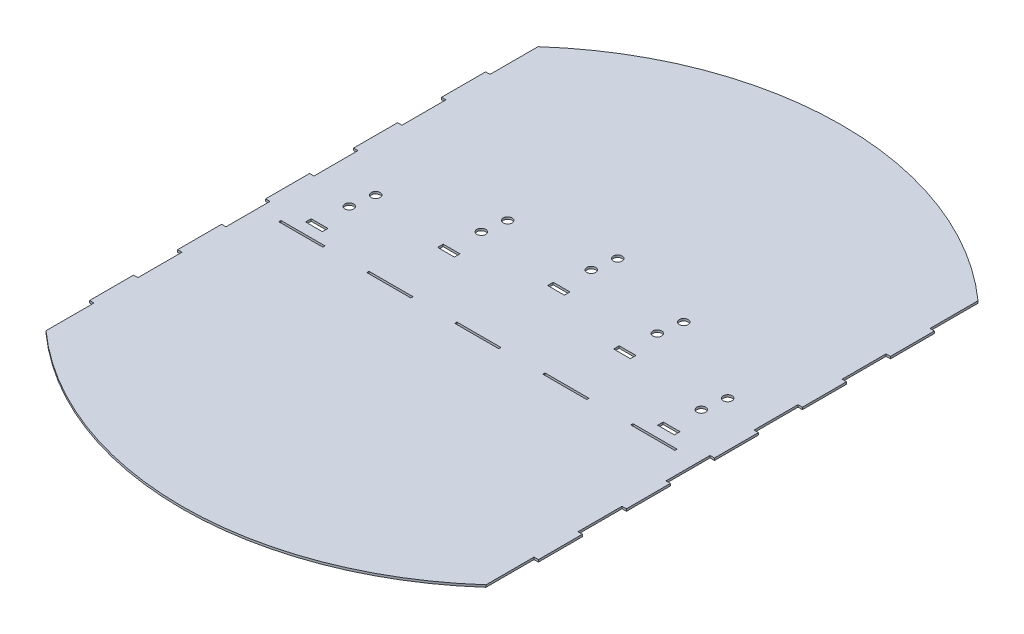
from build123d import *

# Parameters (mm, degrees)
SKICA1_R                = 2
SKICA1_W                = 7.62
SKICA1_H                = 2.54
SKICA1_W_2              = 20
SKICA1_H_2              = 1
P_IDAT_VYSUNUT_M1_DEPTH = 1


with BuildPart() as part:
    # Skica1 → Přidat vysunutím1 (new body)
    with BuildSketch(Plane(origin=(0, 0, 0), x_dir=(1, 0, 0), z_dir=(0, 1, 0))):
        with BuildLine():
            Line((-102, 10), (-102, -10))
            Line((-102, -10), (-100, -10))
            Line((-100, -10), (-100, -30))
            Line((-100, -30), (-102, -30))
            Line((-102, -30), (-102, -50))
            Line((-102, -50), (-100, -50))
            Line((-100, -50), (-100, -70))
            Line((-100, -70), (-102, -70))
            Line((-102, -70), (-102, -90))
            Line((-102, -90), (-100, -90))
            Line((-100, -90), (-100, -111.803398875))
            ThreePointArc((-100, -111.803398875), (0, -150), (100, -111.803398875))
            Line((100, -111.803398875), (100, -90))
            Line((100, -90), (102, -90))
            Line((102, -90), (102, -70))
            Line((102, -70), (100, -70))
            Line((100, -70), (100, -50))
            Line((100, -50), (102, -50))
            Line((102, -50), (102, -30))
            Line((102, -30), (100, -30))
            Line((100, -30), (100, -10))
            Line((100, -10), (102, -10))
            Line((102, -10), (102, 10))
            Line((102, 10), (100, 10))
            Line((100, 10), (100, 30))
            Line((100, 30), (102, 30))
            Line((102, 30), (102, 50))
            Line((102, 50), (100, 50))
            Line((100, 50), (100, 70))
            Line((100, 70), (102, 70))
            Line((102, 70), (102, 90))
            Line((102, 90), (100, 90))
            Line((100, 90), (100, 111.803398875))
            ThreePointArc((100, 111.803398875), (0, 150), (-100, 111.803398875))
            Line((-100, 111.803398875), (-100, 90))
            Line((-100, 90), (-102, 90))
            Line((-102, 90), (-102, 70))
            Line((-102, 70), (-100, 70))
            Line((-100, 70), (-100, 50))
            Line((-100, 50), (-102, 50))
            Line((-102, 50), (-102, 30))
            Line((-102, 30), (-100, 30))
            Line((-100, 30), (-100, 10))
            Line((-100, 10), (-102, 10))
        make_face()
        with Locations((1.5, 46.54)):
            Circle(SKICA1_R, mode=Mode.SUBTRACT)
        with Locations((0, 36.04)):
            Circle(SKICA1_R, mode=Mode.SUBTRACT)
        with Locations((0, 21.27)):
            Rectangle(SKICA1_W, SKICA1_H, mode=Mode.SUBTRACT)
        with Locations((-80, 6.04)):
            Circle(SKICA1_R, mode=Mode.SUBTRACT)
        with Locations((-78.5, 16.54)):
            Circle(SKICA1_R, mode=Mode.SUBTRACT)
        Polygon((-36.19, 10), (-43.81, 10), (-43.81, 12.54), (-40, 12.54), (-36.19, 12.54), align=None, mode=Mode.SUBTRACT)
        with Locations((-40, 26.04)):
            Circle(SKICA1_R, mode=Mode.SUBTRACT)
        with Locations((-38.5, 36.54)):
            Circle(SKICA1_R, mode=Mode.SUBTRACT)
        with Locations((80, 6.04)):
            Circle(SKICA1_R, mode=Mode.SUBTRACT)
        with Locations((81.5, 16.54)):
            Circle(SKICA1_R, mode=Mode.SUBTRACT)
        Polygon((43.81, 12.54), (43.81, 10), (36.19, 10), (36.19, 12.54), (40, 12.54), align=None, mode=Mode.SUBTRACT)
        with Locations((40, 26.04)):
            Circle(SKICA1_R, mode=Mode.SUBTRACT)
        with Locations((41.5, 36.54)):
            Circle(SKICA1_R, mode=Mode.SUBTRACT)
        Polygon((-80, -7.46), (-76.19, -7.46), (-76.19, -10), (-83.81, -10), (-83.81, -7.46), align=None, mode=Mode.SUBTRACT)
        with Locations((0, -15.5)):
            Rectangle(SKICA1_W_2, SKICA1_H_2, mode=Mode.SUBTRACT)
        with Locations((-40, -15.5)):
            Rectangle(SKICA1_W_2, SKICA1_H_2, mode=Mode.SUBTRACT)
        with Locations((-80, -15.5)):
            Rectangle(SKICA1_W_2, SKICA1_H_2, mode=Mode.SUBTRACT)
        Polygon((80, -7.46), (83.81, -7.46), (83.81, -10), (76.19, -10), (76.19, -7.46), align=None, mode=Mode.SUBTRACT)
        with Locations((80, -15.5)):
            Rectangle(SKICA1_W_2, SKICA1_H_2, mode=Mode.SUBTRACT)
        with Locations((40, -15.5)):
            Rectangle(SKICA1_W_2, SKICA1_H_2, mode=Mode.SUBTRACT)
    extrude(amount=P_IDAT_VYSUNUT_M1_DEPTH)


solid = part.part
